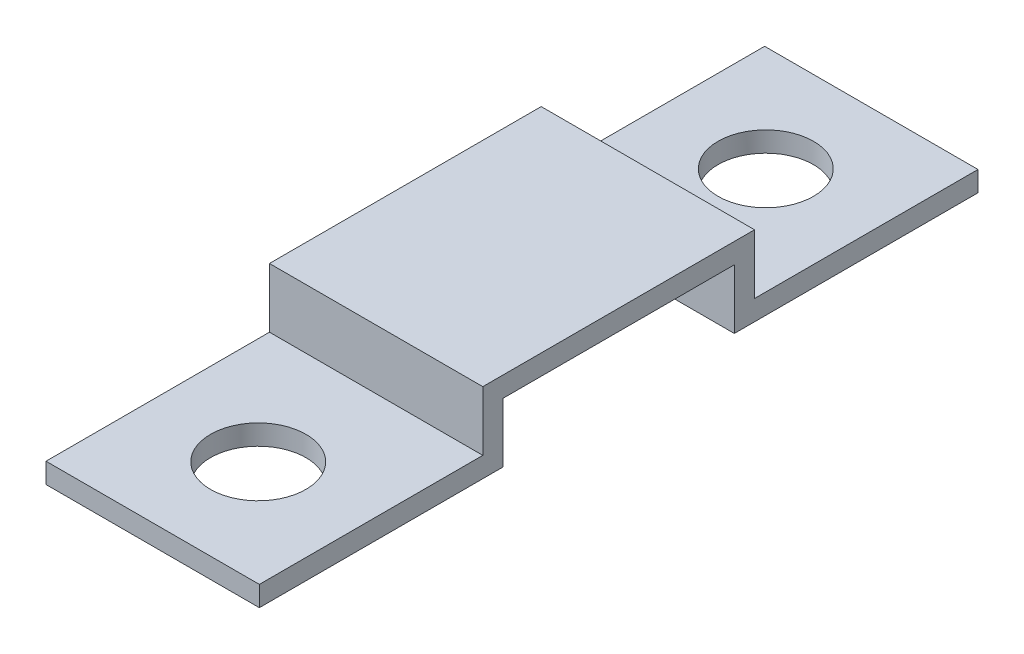
from build123d import *

# Parameters (mm, degrees)
EXTRUDE_5_DEPTH     = 19
SKETCH_6_R          = 4.25
CUT_EXTRUDE_1_DEPTH = 19


with BuildPart() as part:
    # 草图5 → 凸台-拉伸5 (new body)
    with BuildSketch(Plane(origin=(0, 0, 0), x_dir=(0, 0, -1), z_dir=(1, 0, 0))):
        Polygon((12.1, 0), (-12.1, 0), (-12.1, -5.3), (-32, -5.3), (-32, -7.1), (-10.3, -7.1), (-10.3, -1.8), (10.3, -1.8), (10.3, -7.1), (32, -7.1), (32, -5.3), (12.1, -5.3), align=None)
    extrude(amount=EXTRUDE_5_DEPTH)

    # 草图6 → 切除-拉伸1 (cut)
    with BuildSketch(Plane(origin=(0, -5.3, 0), x_dir=(1, 0, 0), z_dir=(0, 1, 0))):
        with Locations((9.5, -22.6)):
            Circle(SKETCH_6_R)
        with Locations((9.5, 22.6)):
            Circle(SKETCH_6_R)
    extrude(amount=-CUT_EXTRUDE_1_DEPTH, mode=Mode.SUBTRACT)


solid = part.part
